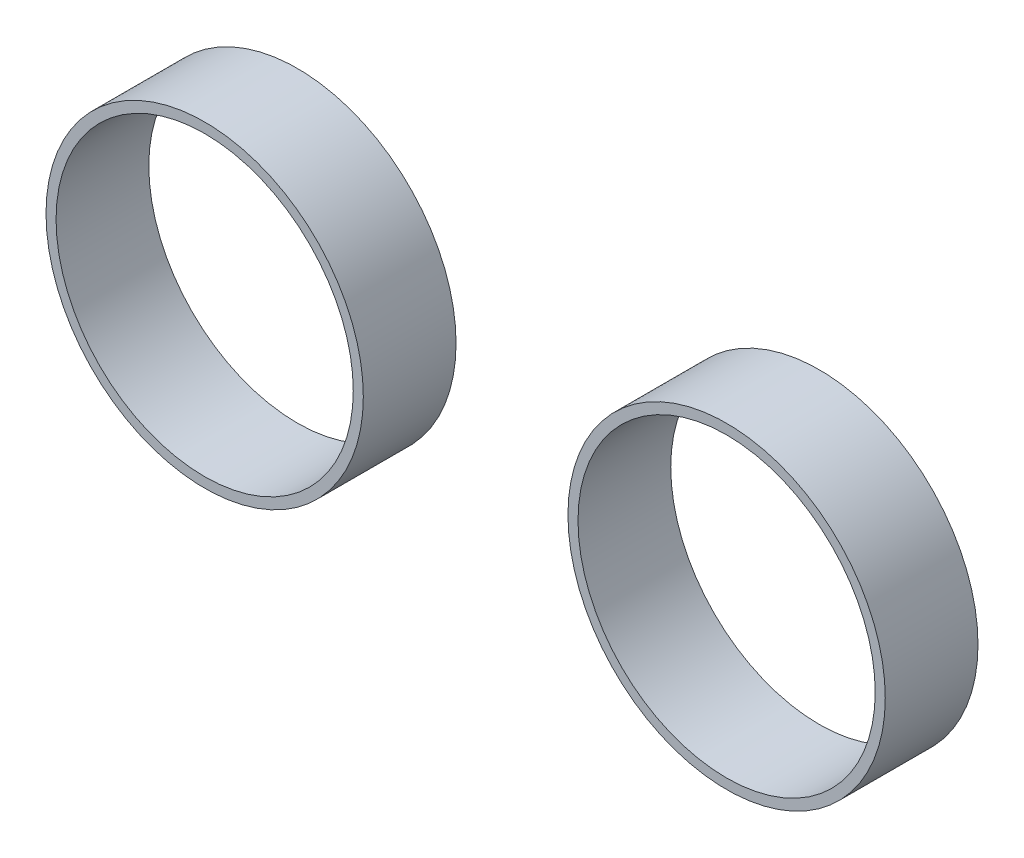
from build123d import *

# Parameters (mm, degrees)
SKETCH1_R             = 69.4
SKETCH1_R_2           = 65
BOSS_EXTRUDE1_DEPTH   = 40.56
BOSS_EXTRUDE1_2_DEPTH = 40.56


with BuildPart() as part:
    # Sketch1 → Boss-Extrude1 (new body)
    with BuildSketch(Plane.XY):
        with Locations((1664.280472759, -423.382336202)):
            Circle(SKETCH1_R)
        with Locations((1664.280472759, -423.382336202)):
            Circle(SKETCH1_R_2, mode=Mode.SUBTRACT)
    extrude(amount=-BOSS_EXTRUDE1_DEPTH)


with BuildPart() as body_2:
    # Sketch1 → Boss-Extrude1 2 (new body)
    with BuildSketch(Plane.XY):
        with Locations((1435.980472759, -423.382336202)):
            Circle(SKETCH1_R)
        with Locations((1435.980472759, -423.382336202)):
            Circle(SKETCH1_R_2, mode=Mode.SUBTRACT)
    extrude(amount=-BOSS_EXTRUDE1_2_DEPTH)


solid = Compound([part.part, body_2.part])
